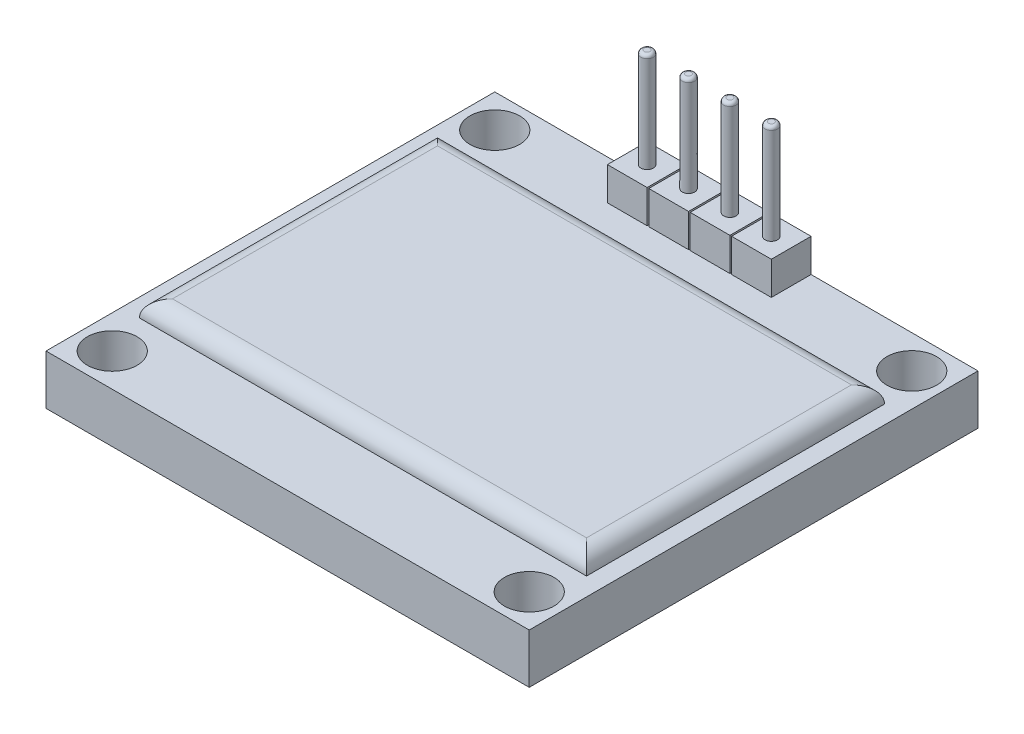
from build123d import *

# Parameters (mm, degrees)
SKETCH1_W           = 29.18
SKETCH1_H           = 27.1
BOSS_EXTRUDE1_DEPTH = 3
SKETCH2_W           = 27
SKETCH2_H           = 18
BOSS_EXTRUDE2_DEPTH = 1
FILLET1_R           = 1
SKETCH3_R           = 1.5
CUT_EXTRUDE1_DEPTH  = 21.136300554
SKETCH4_W           = 2.4
SKETCH4_H           = 2.4
BOSS_EXTRUDE3_DEPTH = 2
SKETCH5_R           = 0.375
BOSS_EXTRUDE4_DEPTH = 6
FILLET2_R           = 0.2


with BuildPart() as part:
    # Sketch1 → Boss-Extrude1 (new body)
    with BuildSketch(Plane(origin=(0, 0, 0), x_dir=(1, 0, 0), z_dir=(0, 1, 0))):
        Rectangle(SKETCH1_W, SKETCH1_H)
    extrude(amount=BOSS_EXTRUDE1_DEPTH)

    # Sketch2 → Boss-Extrude2 (add)
    with BuildSketch(Plane(origin=(0, 3, 0), x_dir=(1, 0, 0), z_dir=(0, 1, 0))):
        Rectangle(SKETCH2_W, SKETCH2_H)
    extrude(amount=BOSS_EXTRUDE2_DEPTH)

    # Fillet1
    fillet1_edges = [part.edges().sort_by_distance(p)[0] for p in [
        (0, 4, -9),
        (13.5, 4, 0),
        (0, 4, 9),
        (-13.5, 4, 0),
    ]]
    fillet(fillet1_edges, radius=FILLET1_R - 0.0001)  # a hair under: the kernel refuses the full size

    # Sketch3 → Cut-Extrude1 (cut, through all)
    with BuildSketch(Plane(origin=(0, 3, 0), x_dir=(1, 0, 0), z_dir=(0, 1, 0))):
        with Locations(Location((-12.59, 11.55, 0), (0, 0, 270))):
            Circle(SKETCH3_R)
        with Locations(Location((12.59, 11.55, 0), (0, 0, 270))):
            Circle(SKETCH3_R)
        with Locations(Location((12.59, -11.55, 0), (0, 0, 90))):
            Circle(SKETCH3_R)
        with Locations(Location((-12.59, -11.55, 0), (0, 0, 90))):
            Circle(SKETCH3_R)
    extrude(amount=-CUT_EXTRUDE1_DEPTH, mode=Mode.SUBTRACT)

    # Sketch4 → Boss-Extrude3 (add)
    with BuildSketch(Plane(origin=(0, 3, 0), x_dir=(1, 0, 0), z_dir=(0, 1, 0))):
        with Locations((-4.19, 12.35)):
            Rectangle(SKETCH4_W, SKETCH4_H)
        with Locations((-1.69, 12.35)):
            Rectangle(SKETCH4_W, SKETCH4_H)
        with Locations((0.81, 12.35)):
            Rectangle(SKETCH4_W, SKETCH4_H)
        with Locations((3.31, 12.35)):
            Rectangle(SKETCH4_W, SKETCH4_H)
    extrude(amount=BOSS_EXTRUDE3_DEPTH)

    # Sketch5 → Boss-Extrude4 (add)
    with BuildSketch(Plane(origin=(0, 5, 0), x_dir=(1, 0, 0), z_dir=(0, 1, 0))):
        with Locations(Location((-4.19, 12.35, 0), (0, 0, 90))):
            Circle(SKETCH5_R)
        with Locations(Location((-1.69, 12.35, 0), (0, 0, 90))):
            Circle(SKETCH5_R)
        with Locations(Location((0.81, 12.35, 0), (0, 0, 90))):
            Circle(SKETCH5_R)
        with Locations(Location((3.31, 12.35, 0), (0, 0, 90))):
            Circle(SKETCH5_R)
    extrude(amount=BOSS_EXTRUDE4_DEPTH)

    # Fillet2
    fillet2_edges = [part.edges().sort_by_distance(p)[0] for p in [
        (-4.19, 11, -11.975),
        (-1.69, 11, -11.975),
        (0.81, 11, -11.975),
        (3.31, 11, -11.975),
    ]]
    fillet(fillet2_edges, radius=FILLET2_R)


solid = part.part
